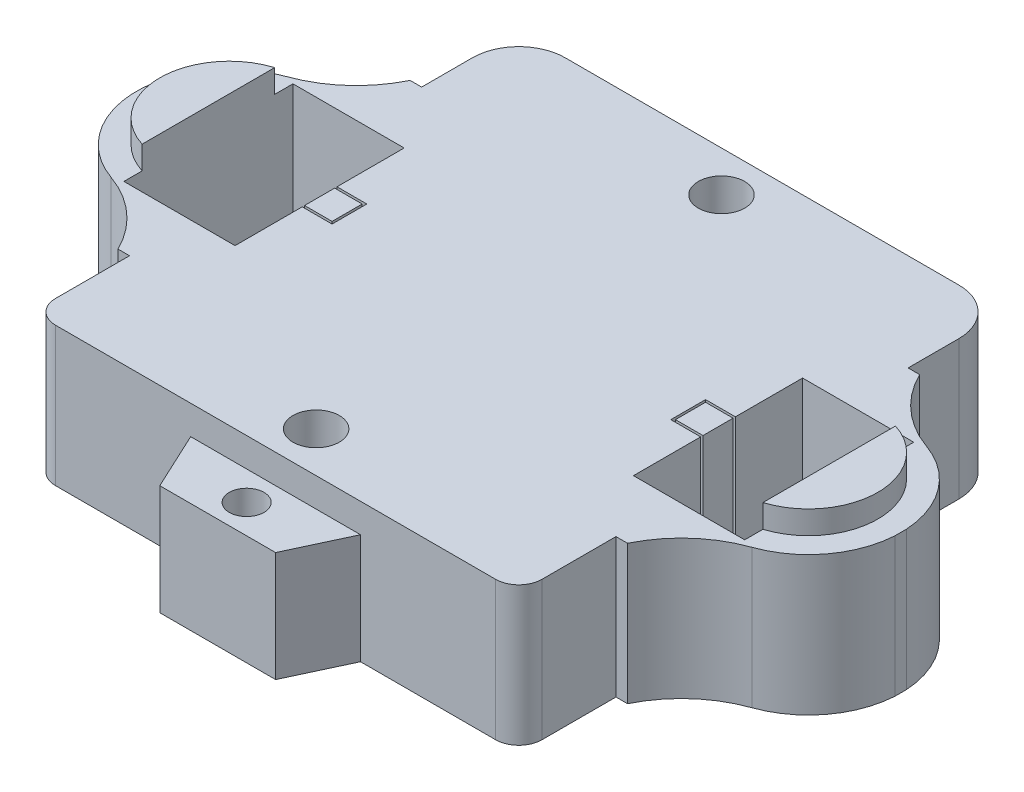
from build123d import *
from build123d.topology import SkipClean

# Parameters (mm, degrees)
SKETCH_1_W          = 42
SKETCH_1_H          = 42
EXTRUDE_1_DEPTH     = 2
EXTRUDE_2_DEPTH     = 0.5
SKETCH_3_R          = 2
SKETCH_3_R_2        = 1
CUT_EXTRUDE_1_DEPTH = 30.803523282
EXTRUDE_START       = -12
EXTRUDE_3_OUTLINE_R = 2
EXTRUDE_3_DEPTH     = 12
EXTRUDE_4_DEPTH     = 2
EXTRUDE_5_DEPTH     = 9.5
DRAFT_1_DEPTH       = 9.5
SKETCH_8_R          = 2
CUT_EXTRUDE_2_DEPTH = 7
CUT_EXTRUDE_3_REACH = 46.272
SKETCH_9_W          = 9.6
SKETCH_9_H          = 14.6
SKETCH_9_W_2        = 9
SKETCH_9_H_2        = 14


# Read off the part's stored shape, not the designer's step: Бобышка-Вытянуть3, Уклон1
with BuildPart() as part:
    # Эскиз1 → Бобышка-Вытянуть1 (new body)
    with BuildSketch(Plane(origin=(0, 0, 0), x_dir=(1, 0, 0), z_dir=(0, 1, 0))):
        Rectangle(SKETCH_1_W, SKETCH_1_H)
    extrude(amount=EXTRUDE_1_DEPTH)

    # Эскиз2 → Бобышка-Вытянуть2 (add)
    with BuildSketch(Plane(origin=(0, 2, 0), x_dir=(1, 0, 0), z_dir=(0, 1, 0))):
        with BuildLine():
            Line((-1.778376117, -14.123475383), (1.778376117, -14.123475383))
            ThreePointArc((1.778376117, -14.123475383), (15.863961031, -15.863961031), (14.123475383, -1.778376117))
            Line((14.123475383, -1.778376117), (14.123475383, 1.778376117))
            ThreePointArc((14.123475383, 1.778376117), (15.863961031, 15.863961031), (1.778376117, 14.123475383))
            Line((1.778376117, 14.123475383), (-1.778376117, 14.123475383))
            ThreePointArc((-1.778376117, 14.123475383), (-15.863961031, 15.863961031), (-14.123475383, 1.778376117))
            Line((-14.123475383, 1.778376117), (-14.123475383, -1.778376117))
            ThreePointArc((-14.123475383, -1.778376117), (-15.863961031, -15.863961031), (-1.778376117, -14.123475383))
        make_face()
    extrude(amount=EXTRUDE_2_DEPTH)

    # Эскиз3 → Вырез-Вытянуть1 (cut, through all)
    # profile 1 of 7: a face of its own
    with BuildSketch(Plane.XZ):
        with Locations(Location((0, -17.5, 0), (0, 0, 270))):
            Circle(SKETCH_3_R)
        with Locations((0, -17.5)):
            Circle(SKETCH_3_R_2, mode=Mode.SUBTRACT)
    # profile 2 of 7: a face of its own
    with BuildSketch(Plane.XZ):
        with BuildLine():
            Line((-21, -21), (-17, -21))
            ThreePointArc((-17, -21), (-19.828427125, -19.828427125), (-21, -17))
            Line((-21, -17), (-21, -21))
        make_face()
    # profile 3 of 7: a face of its own
    with BuildSketch(Plane.XZ):
        with BuildLine():
            ThreePointArc((21, -17), (19.828427125, -19.828427125), (17, -21))
            Line((17, -21), (21, -21))
            Line((21, -21), (21, -17))
        make_face()
    # profile 4 of 7: a face of its own
    with BuildSketch(Plane.XZ):
        with BuildLine():
            Line((21, 21), (19, 21))
            ThreePointArc((19, 21), (20.414213562, 20.414213562), (21, 19))
            Line((21, 19), (21, 21))
        make_face()
    # profile 5 of 7: a face of its own
    with BuildSketch(Plane.XZ):
        with Locations(Location((0, 17.5, 0), (0, 0, 270))):
            Circle(SKETCH_3_R)
        with Locations((0, 17.5)):
            Circle(SKETCH_3_R_2, mode=Mode.SUBTRACT)
    # profile 6 of 7: a face of its own
    with BuildSketch(Plane.XZ):
        with Locations((0, 17.5)):
            Circle(SKETCH_3_R_2)
    # profile 7 of 7: a face of its own
    with BuildSketch(Plane.XZ):
        with BuildLine():
            Line((-21, 21), (-21, 19))
            ThreePointArc((-21, 19), (-20.414213562, 20.414213562), (-19, 21))
            Line((-19, 21), (-21, 21))
        make_face()
    extrude(amount=-CUT_EXTRUDE_1_DEPTH, mode=Mode.SUBTRACT)


with BuildPart() as cut_extrude_1_kept_piece:
    # of the separate pieces the step leaves, the one the design keeps (cut_extrude_1_pieces_kept)
    add(part.part.solids().sort_by_distance((-19, 0, 21))[0])

    # Бобышка-Вытянуть3 outline → Бобышка-Вытянуть3 (add)
    with SkipClean():  # the faces are left unmerged after this step: merging them gives an invalid solid
        with BuildSketch(Plane.XZ.offset(EXTRUDE_START)):
            with BuildLine():
                Line((-22, -12.611663805), (-21, -12.611663805))
                Line((-21, -12.611663805), (-21, -17))
                ThreePointArc((-21, -17), (-19.828427125, -19.828427125), (-17, -21))
                Line((-17, -21), (17, -21))
                ThreePointArc((17, -21), (19.828427125, -19.828427125), (21, -17))
                Line((21, -17), (21, -12.611663805))
                Line((21, -12.611663805), (22, -12.611663805))
                ThreePointArc((22, -12.611663805), (24.332770191, -9.517506551), (27.666666667, -7.542472333))
                ThreePointArc((27.666666667, -7.542472333), (31.384371141, -4.820768106), (32.984359711, -0.5))
                Line((32.984359711, -0.5), (32.984359711, 0.5))
                ThreePointArc((32.984359711, 0.5), (31.384371141, 4.820768106), (27.666666667, 7.542472333))
                ThreePointArc((27.666666667, 7.542472333), (24.332770191, 9.517506551), (22, 12.611663805))
                Line((22, 12.611663805), (21, 12.611663805))
                Line((21, 12.611663805), (21, 19))
                ThreePointArc((21, 19), (20.414213562, 20.414213562), (19, 21))
                Line((19, 21), (-19, 21))
                ThreePointArc((-19, 21), (-20.414213562, 20.414213562), (-21, 19))
                Line((-21, 19), (-21, 12.611663805))
                Line((-21, 12.611663805), (-22, 12.611663805))
                ThreePointArc((-22, 12.611663805), (-24.332770191, 9.517506551), (-27.666666667, 7.542472333))
                ThreePointArc((-27.666666667, 7.542472333), (-31.384371141, 4.820768106), (-32.984359711, 0.5))
                Line((-32.984359711, 0.5), (-32.984359711, -0.5))
                ThreePointArc((-32.984359711, -0.5), (-31.384371141, -4.820768106), (-27.666666667, -7.542472333))
                ThreePointArc((-27.666666667, -7.542472333), (-24.332770191, -9.517506551), (-22, -12.611663805))
            make_face()
            with BuildLine():
                Line((-26.8, 7.3), (-21, 7.3))
                Line((-21, 7.3), (-21, 5.123475383))
                ThreePointArc((-21, 5.123475383), (-23.765130637, 6.381621867), (-26.8, 6.245798588))
                Line((-26.8, 6.245798588), (-26.8, 7.3))
            make_face(mode=Mode.SUBTRACT)
            with BuildLine():
                Line((14.623475383, -1.5), (14.623475383, 1.5))
                Line((14.623475383, 1.5), (18.67544468, 1.5))
                ThreePointArc((18.67544468, 1.5), (18.652597901, 1.400173775), (18.631326669, 1.3))
                Line((18.631326669, 1.3), (14.823475383, 1.3))
                Line((14.823475383, 1.3), (14.823475383, -1.3))
                Line((14.823475383, -1.3), (18.631326669, -1.3))
                ThreePointArc((18.631326669, -1.3), (18.652597901, -1.400173775), (18.67544468, -1.5))
                Line((18.67544468, -1.5), (14.623475383, -1.5))
            make_face(mode=Mode.SUBTRACT)
            with Locations((0, 17.5)):
                Circle(EXTRUDE_3_OUTLINE_R, mode=Mode.SUBTRACT)
            with Locations((0, -17.5)):
                Circle(EXTRUDE_3_OUTLINE_R, mode=Mode.SUBTRACT)
            with BuildLine():
                Line((-14.623475383, -1.5), (-18.67544468, -1.5))
                ThreePointArc((-18.67544468, -1.5), (-18.652597901, -1.400173775), (-18.631326669, -1.3))
                Line((-18.631326669, -1.3), (-14.823475383, -1.3))
                Line((-14.823475383, -1.3), (-14.823475383, 1.3))
                Line((-14.823475383, 1.3), (-18.631326669, 1.3))
                ThreePointArc((-18.631326669, 1.3), (-18.652597901, 1.400173775), (-18.67544468, 1.5))
                Line((-18.67544468, 1.5), (-14.623475383, 1.5))
                Line((-14.623475383, 1.5), (-14.623475383, -1.5))
            make_face(mode=Mode.SUBTRACT)
        extrude(amount=EXTRUDE_3_DEPTH)

    # Эскиз6 → Бобышка-Вытянуть4 (add)
    with SkipClean():  # the faces are left unmerged after this step: merging them gives an invalid solid
        with BuildSketch(Plane(origin=(0, 12, 0), x_dir=(1, 0, 0), z_dir=(0, 1, 0))):
            with BuildLine():
                ThreePointArc((-19.161948935, -1.384615385), (-19, 0), (-19.161948935, 1.384615385))
                ThreePointArc((-19.161948935, 1.384615385), (-19.949874575, 3.239789066), (-21.307692308, 4.729361892))
                ThreePointArc((-21.307692308, 4.729361892), (-31, 0), (-21.307692308, -4.729361892))
                ThreePointArc((-21.307692308, -4.729361892), (-19.949874575, -3.239789066), (-19.161948935, -1.384615385))
            make_face()
            with BuildLine():
                ThreePointArc((19.161948935, 1.384615385), (19, 0), (19.161948935, -1.384615385))
                ThreePointArc((19.161948935, -1.384615385), (19.949874575, -3.239789066), (21.307692308, -4.729361892))
                ThreePointArc((21.307692308, -4.729361892), (31, 0), (21.307692308, 4.729361892))
                ThreePointArc((21.307692308, 4.729361892), (19.949874575, 3.239789066), (19.161948935, 1.384615385))
            make_face()
        extrude(amount=EXTRUDE_4_DEPTH)

    # Эскиз7 → Бобышка-Вытянуть5 (add)
    with SkipClean():  # the faces are left unmerged after this step: merging them gives an invalid solid
        with BuildSketch(Plane.XZ):
            with BuildLine():
                Line((0, 22), (0, 21))
                Line((0, 21), (5, 21))
                Line((5, 21), (5, 26))
                Line((5, 26), (0, 26))
                Line((0, 26), (0, 25))
                ThreePointArc((0, 25), (1.060660172, 24.560660172), (1.5, 23.5))
                ThreePointArc((1.5, 23.5), (1.060660172, 22.439339828), (0, 22))
            make_face()
            with BuildLine():
                Line((-5, 21), (0, 21))
                Line((0, 21), (0, 22))
                ThreePointArc((0, 22), (-1.5, 23.5), (0, 25))
                Line((0, 25), (0, 26))
                Line((0, 26), (-5, 26))
                Line((-5, 26), (-5, 21))
            make_face()
        extrude(amount=-EXTRUDE_5_DEPTH)

    # Уклон1 outline → Уклон1 (add)
    with SkipClean():  # the faces are left unmerged after this step: merging them gives an invalid solid
        with BuildSketch(Plane(origin=(0, 0, 0), x_dir=(1, 0, 0), z_dir=(0, 1, 0))):
            Polygon((-5, -21), (-7.331538291, -21), (-5, -26), align=None)
            Polygon((7.331538291, -21), (5, -21), (5, -26), align=None)
        extrude(amount=DRAFT_1_DEPTH)

    # Эскиз8 → Вырез-Вытянуть2 (cut)
    with SkipClean():  # the faces are left unmerged after this step: merging them gives an invalid solid
        with BuildSketch(Plane.XZ):
            with Locations(Location((0, 23.5, 0), (0, 0, 270))):
                Circle(SKETCH_8_R)
        extrude(amount=-CUT_EXTRUDE_2_DEPTH, mode=Mode.SUBTRACT)

    # Эскиз9 → Вырез-Вытянуть3 (cut, up to next)
    with BuildSketch(Plane.XZ, mode=Mode.PRIVATE) as cut_extrude_3_sk1:
        with Locations((-22, 0)):
            Rectangle(SKETCH_9_W, SKETCH_9_H)
        with Locations((-22, 0)):
            Rectangle(SKETCH_9_W_2, SKETCH_9_H_2, mode=Mode.SUBTRACT)
    cut_extrude_3_tool1 = extrude(cut_extrude_3_sk1.sketch, amount=-CUT_EXTRUDE_3_REACH, mode=Mode.PRIVATE) & cut_extrude_1_kept_piece.part
    # Эскиз9 → Вырез-Вытянуть3 (cut, up to next)
    with BuildSketch(Plane.XZ, mode=Mode.PRIVATE) as cut_extrude_3_sk2:
        with Locations((-22, 0)):
            Rectangle(SKETCH_9_W_2, SKETCH_9_H_2)
    cut_extrude_3_tool2 = extrude(cut_extrude_3_sk2.sketch, amount=-CUT_EXTRUDE_3_REACH, mode=Mode.PRIVATE) & cut_extrude_1_kept_piece.part
    # Эскиз9 → Вырез-Вытянуть3 (cut, up to next)
    with BuildSketch(Plane.XZ, mode=Mode.PRIVATE) as cut_extrude_3_sk3:
        with Locations((22, 0)):
            Rectangle(SKETCH_9_W, SKETCH_9_H)
        with Locations((22, 0)):
            Rectangle(SKETCH_9_W_2, SKETCH_9_H_2, mode=Mode.SUBTRACT)
    cut_extrude_3_tool3 = extrude(cut_extrude_3_sk3.sketch, amount=-CUT_EXTRUDE_3_REACH, mode=Mode.PRIVATE) & cut_extrude_1_kept_piece.part
    # Эскиз9 → Вырез-Вытянуть3 (cut, up to next)
    with BuildSketch(Plane.XZ, mode=Mode.PRIVATE) as cut_extrude_3_sk4:
        with Locations((22, 0)):
            Rectangle(SKETCH_9_W_2, SKETCH_9_H_2)
    cut_extrude_3_tool4 = extrude(cut_extrude_3_sk4.sketch, amount=-CUT_EXTRUDE_3_REACH, mode=Mode.PRIVATE) & cut_extrude_1_kept_piece.part
    add(cut_extrude_3_tool1.solids().sort_by_distance((-26.625266, 0, 0))[0], mode=Mode.SUBTRACT)
    add(cut_extrude_3_tool2.solids().sort_by_distance((-22, 0, 0))[0], mode=Mode.SUBTRACT)
    add(cut_extrude_3_tool3.solids().sort_by_distance((17.374734, 0, 0))[0], mode=Mode.SUBTRACT)
    add(cut_extrude_3_tool4.solids().sort_by_distance((22, 0, 0))[0], mode=Mode.SUBTRACT)


solid = cut_extrude_1_kept_piece.part
